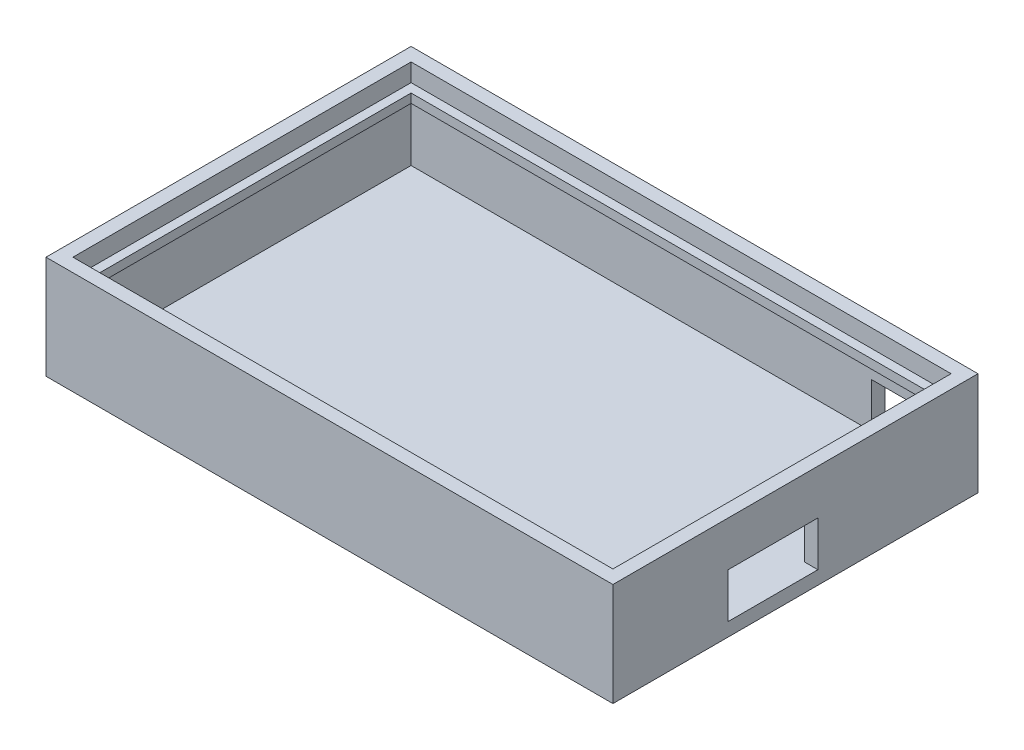
from build123d import *

# Parameters (mm, degrees)
BOSS_EXTRUDE1_DEPTH = 3
SKETCH2_W           = 126.4
SKETCH2_H           = 81.4
SKETCH2_W_2         = 120.4
SKETCH2_H_2         = 75.4
BOSS_EXTRUDE2_DEPTH = 20
SKETCH4_W           = 7.2
SKETCH4_H           = 20
CUT_EXTRUDE1_DEPTH  = 10
SKETCH5_W           = 15
SKETCH5_H           = 12.33485255
CUT_EXTRUDE2_DEPTH  = 10
BOSS_EXTRUDE3_START = -4
SKETCH6_W           = 120.4
SKETCH6_H           = 75.4
SKETCH6_W_2         = 116.4
SKETCH6_H_2         = 71.4
BOSS_EXTRUDE3_DEPTH = 2
CHAMFER1_SIZE       = 2


with BuildPart() as part:
    # Sketch1 → Boss-Extrude1 (new body)
    with BuildSketch(Plane(origin=(0, 0, 0), x_dir=(1, 0, 0), z_dir=(0, 1, 0))):
        Polygon((63.2, 40.7), (-63.2, 40.7), (-63.2, -40.7), (63.2, -40.7), (63.2, -15), (63.2, 5), align=None)
    extrude(amount=BOSS_EXTRUDE1_DEPTH)

    # Sketch2 → Boss-Extrude2 (add)
    with BuildSketch(Plane(origin=(0, 3, 0), x_dir=(1, 0, 0), z_dir=(0, 1, 0))):
        Rectangle(SKETCH2_W, SKETCH2_H)
        Rectangle(SKETCH2_W_2, SKETCH2_H_2, mode=Mode.SUBTRACT)
    extrude(amount=BOSS_EXTRUDE2_DEPTH)

    # Sketch4 → Cut-Extrude1 (cut)
    with BuildSketch(Plane(origin=(0, 3, 0), x_dir=(1, 0, 0), z_dir=(0, 1, 0))):
        with Locations((59.6, -5)):
            Rectangle(SKETCH4_W, SKETCH4_H)
    extrude(amount=CUT_EXTRUDE1_DEPTH, mode=Mode.SUBTRACT)

    # Sketch5 → Cut-Extrude2 (cut)
    with BuildSketch(Plane(origin=(0, 3, 0), x_dir=(1, 0, 0), z_dir=(0, 1, 0))):
        with Locations((50, 37.5)):
            Rectangle(SKETCH5_W, SKETCH5_H)
    extrude(amount=CUT_EXTRUDE2_DEPTH, mode=Mode.SUBTRACT)

    # Sketch6 → Boss-Extrude3 (add)
    with BuildSketch(Plane(origin=(0, 23, 0), x_dir=(1, 0, 0), z_dir=(0, 1, 0)).offset(BOSS_EXTRUDE3_START)):
        Rectangle(SKETCH6_W, SKETCH6_H)
        Rectangle(SKETCH6_W_2, SKETCH6_H_2, mode=Mode.SUBTRACT)
    extrude(amount=-BOSS_EXTRUDE3_DEPTH)

    # Chamfer1
    chamfer1_edges = [part.edges().sort_by_distance(p)[0] for p in [
        (0, 17, 37.7),
        (-60.2, 17, 0),
        (0, 17, -37.7),
        (60.2, 17, 0),
    ]]
    chamfer(chamfer1_edges, length=CHAMFER1_SIZE - 0.0001)  # a hair under: the kernel refuses the full size


solid = part.part
